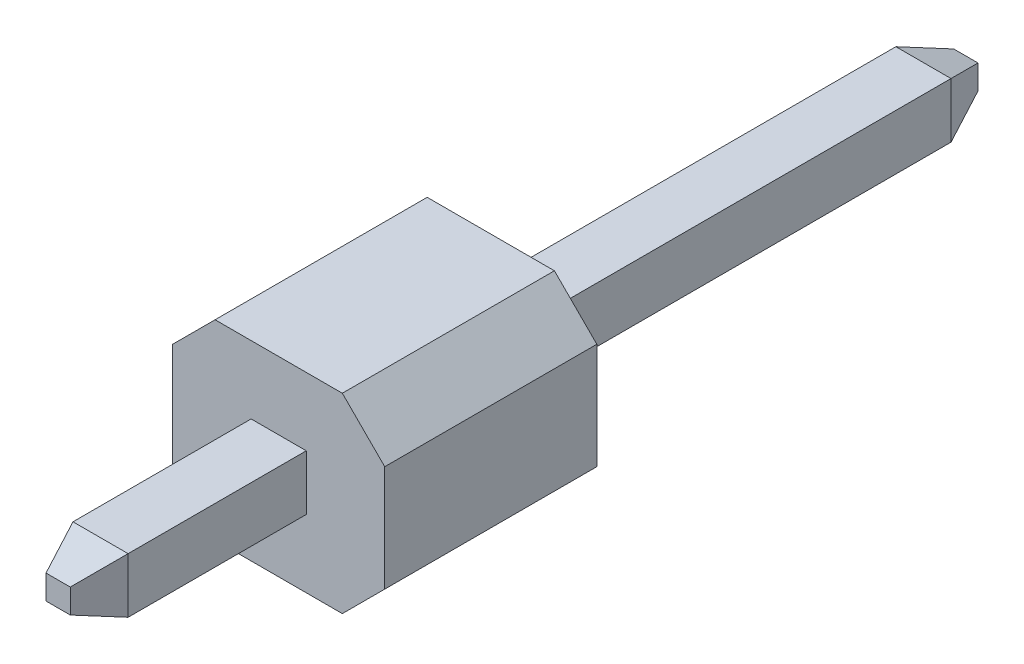
from build123d import *

# Parameters (mm, degrees)
SKETCH1_W                = 2.5
SKETCH1_H                = 2.25
BOSS_EXTRUDE1_DEPTH      = 1.25
BOSS_EXTRUDE2_DEPTH      = 3.35
BOSS_EXTRUDE2_DEPTH_BACK = 6.35
SKETCH2_W                = 0.65
SKETCH2_H                = 0.65
SKETCH3_W                = 0.65
SKETCH3_H                = 0.65
BOSS_EXTRUDE3_DEPTH      = 0.5
BOSS_EXTRUDE3_TAPER      = 20
SKETCH7_W                = 0.65
SKETCH7_H                = 0.65
BOSS_EXTRUDE6_DEPTH      = 0.5
BOSS_EXTRUDE6_TAPER      = 20
CHAMFER1_SIZE            = 0.5


with BuildPart() as part:
    # Sketch1 → Boss-Extrude1 (new, symmetric)
    with BuildSketch(Plane.XY):
        Rectangle(SKETCH1_W, SKETCH1_H)
    extrude(amount=BOSS_EXTRUDE1_DEPTH, both=True)

    # Sketch2 → Boss-Extrude2 (add, two sides: drawn at the far end of the back side and taken through both)
    with BuildSketch(Plane.XY.offset(-BOSS_EXTRUDE2_DEPTH_BACK)):
        Rectangle(SKETCH2_W, SKETCH2_H)
    extrude(amount=BOSS_EXTRUDE2_DEPTH + BOSS_EXTRUDE2_DEPTH_BACK)

    # Sketch3 → Boss-Extrude3 (add)
    with BuildSketch(Plane(origin=(0, 0, -6.35), x_dir=(-1, 0, 0), z_dir=(0, 0, -1))):
        Rectangle(SKETCH3_W, SKETCH3_H)
    extrude(amount=BOSS_EXTRUDE3_DEPTH, taper=BOSS_EXTRUDE3_TAPER)

    # Sketch7 → Boss-Extrude6 (add)
    with BuildSketch(Plane.XY.offset(3.35)):
        Rectangle(SKETCH7_W, SKETCH7_H)
    extrude(amount=BOSS_EXTRUDE6_DEPTH, taper=BOSS_EXTRUDE6_TAPER)

    # Chamfer1
    chamfer1_edges = [part.edges().sort_by_distance(p)[0] for p in [
        (-1.25, -1.125, 0),
        (1.25, -1.125, 0),
        (1.25, 1.125, 0),
        (-1.25, 1.125, 0),
    ]]
    chamfer(chamfer1_edges, length=CHAMFER1_SIZE)


solid = part.part
